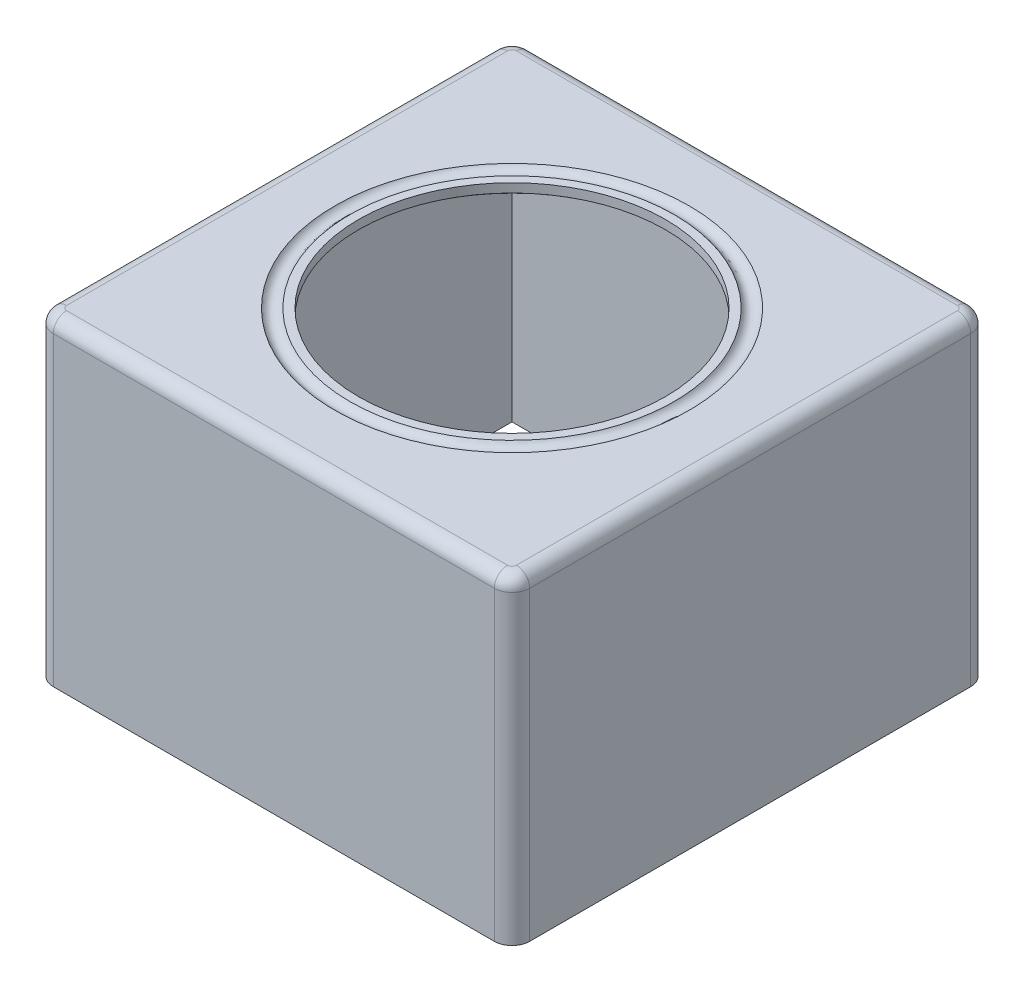
from build123d import *

# Parameters (mm, degrees)
SKETCH1_W           = 99.503865414
SKETCH1_H           = 99.503865414
BOSS_EXTRUDE1_DEPTH = 70
SKETCH2_R           = 41.055084084
BOSS_EXTRUDE2_DEPTH = 2
FILLET1_R           = 3


with BuildPart() as part:
    # Sketch1 → Boss-Extrude1 (new body)
    with BuildSketch(Plane(origin=(0, 0, 0), x_dir=(1, 0, 0), z_dir=(0, 1, 0))):
        with BuildLine():
            Line((-49.751932707, -53.751932707), (49.751932707, -53.751932707))
            ThreePointArc((49.751932707, -53.751932707), (52.580359832, -52.580359832), (53.751932707, -49.751932707))
            Line((53.751932707, -49.751932707), (53.751932707, 49.751932707))
            ThreePointArc((53.751932707, 49.751932707), (52.580359832, 52.580359832), (49.751932707, 53.751932707))
            Line((49.751932707, 53.751932707), (-49.751932707, 53.751932707))
            ThreePointArc((-49.751932707, 53.751932707), (-52.580359832, 52.580359832), (-53.751932707, 49.751932707))
            Line((-53.751932707, 49.751932707), (-53.751932707, -49.751932707))
            ThreePointArc((-53.751932707, -49.751932707), (-52.580359832, -52.580359832), (-49.751932707, -53.751932707))
        make_face()
        Rectangle(SKETCH1_W, SKETCH1_H, mode=Mode.SUBTRACT)
    extrude(amount=BOSS_EXTRUDE1_DEPTH)

    # Sketch2 → Boss-Extrude2 (add)
    with BuildSketch(Plane(origin=(0, 70, 0), x_dir=(1, 0, 0), z_dir=(0, 1, 0))):
        with BuildLine():
            Line((-49.751932707, -53.751932707), (49.751932707, -53.751932707))
            ThreePointArc((49.751932707, -53.751932707), (52.580359832, -52.580359832), (53.751932707, -49.751932707))
            Line((53.751932707, -49.751932707), (53.751932707, 49.751932707))
            ThreePointArc((53.751932707, 49.751932707), (52.580359832, 52.580359832), (49.751932707, 53.751932707))
            Line((49.751932707, 53.751932707), (-49.751932707, 53.751932707))
            ThreePointArc((-49.751932707, 53.751932707), (-52.580359832, 52.580359832), (-53.751932707, 49.751932707))
            Line((-53.751932707, 49.751932707), (-53.751932707, -49.751932707))
            ThreePointArc((-53.751932707, -49.751932707), (-52.580359832, -52.580359832), (-49.751932707, -53.751932707))
        make_face()
        Circle(SKETCH2_R, mode=Mode.SUBTRACT)
    extrude(amount=BOSS_EXTRUDE2_DEPTH)

    # Fillet1
    fillet1_edges = [part.edges().sort_by_distance(p)[0] for p in [
        (52.580359832, 72, 52.580359832),
        (0, 72, 53.751932707),
        (-52.580359832, 72, 52.580359832),
        (-53.751932707, 72, 0),
        (-52.580359832, 72, -52.580359832),
        (0, 72, -53.751932707),
        (52.580359832, 72, -52.580359832),
        (53.751932707, 72, 0),
    ]]
    fillet(fillet1_edges, radius=FILLET1_R)

    # Sketch6 → Revolve1 (revolve)
    with BuildSketch(Plane(origin=(0, 0, 0), x_dir=(0, 0, -1), z_dir=(1, 0, 0))):
        with BuildLine():
            Line((-41.906282127, 70), (-41.906282127, 72))
            Line((-41.906282127, 72), (-39.977926792, 72))
            ThreePointArc((-39.977926792, 72), (-38.268844469, 71.01399696), (-36.559762147, 72))
            Line((-36.559762147, 72), (-34.631406812, 72))
            Line((-34.631406812, 72), (-34.631406812, 70))
            ThreePointArc((-34.631406812, 70), (-38.268844469, 68.645456934), (-41.906282127, 70))
        make_face()
    revolve(axis=Axis((0, 0, 0), (0, 1, 0)))


solid = part.part
